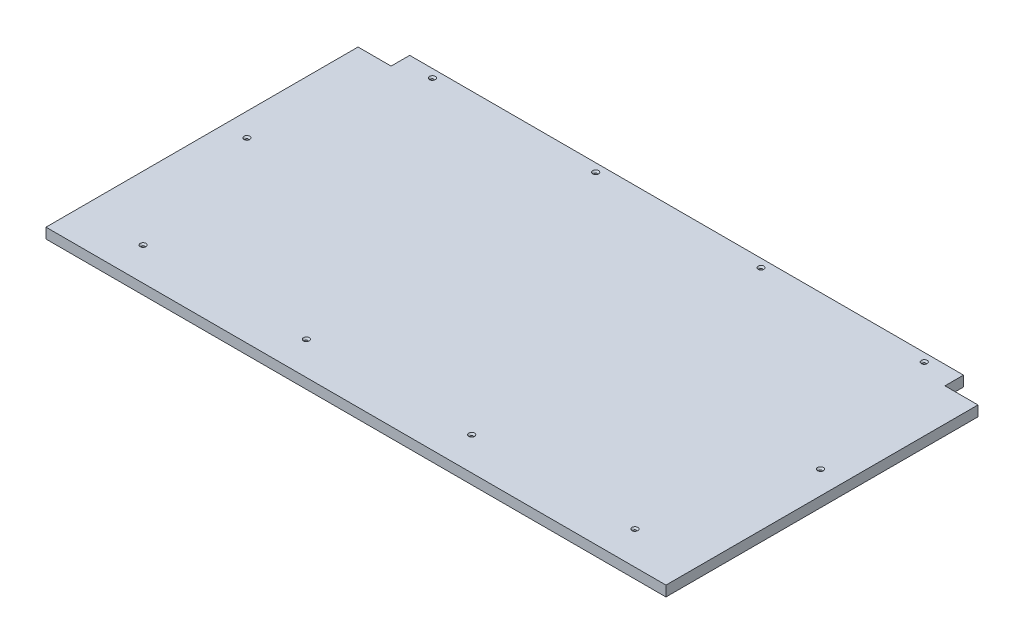
from build123d import *

# Parameters (mm, degrees)
SKETCH1_W                      = 1500
SKETCH1_H                      = 800
RAWMATERIAL_DEPTH              = 25
SKETCH2_W                      = 80
SKETCH2_H                      = 45
SLOTSFORFRAME_DEPTH            = 851.367567585
M6_CLEARANCE_HOLE1_D           = 6.6
M6_CLEARANCE_HOLE1_CSINK_D     = 14
M6_CLEARANCE_HOLE1_CSINK_ANGLE = 90


with BuildPart() as part:
    # Sketch1 → RawMaterial (new body)
    with BuildSketch(Plane(origin=(0, 0, 0), x_dir=(1, 0, 0), z_dir=(0, 1, 0))):
        Rectangle(SKETCH1_W, SKETCH1_H)
    extrude(amount=RAWMATERIAL_DEPTH)

    # Sketch2 → SlotsForFrame (cut, through all)
    with BuildSketch(Plane(origin=(0, 25, 0), x_dir=(1, 0, 0), z_dir=(0, 1, 0))):
        with Locations((710, 377.5)):
            Rectangle(SKETCH2_W, SKETCH2_H)
        with Locations((-710, 377.5)):
            Rectangle(SKETCH2_W, SKETCH2_H)
    extrude(amount=-SLOTSFORFRAME_DEPTH, mode=Mode.SUBTRACT)

    # M6 Clearance Hole1 (through all)
    with Locations(Plane(origin=(0, 25, 0), x_dir=(-1, 0, 0), z_dir=(0, 1, 0))):
        with Locations((-595, 320), (-200, 320), (200, 320), (595, 320), (694, -30), (-694, -30), (-595, -380), (-200, -380), (200, -380), (595, -380)):
            CounterSinkHole(M6_CLEARANCE_HOLE1_D / 2, M6_CLEARANCE_HOLE1_CSINK_D / 2, counter_sink_angle=M6_CLEARANCE_HOLE1_CSINK_ANGLE)


solid = part.part
